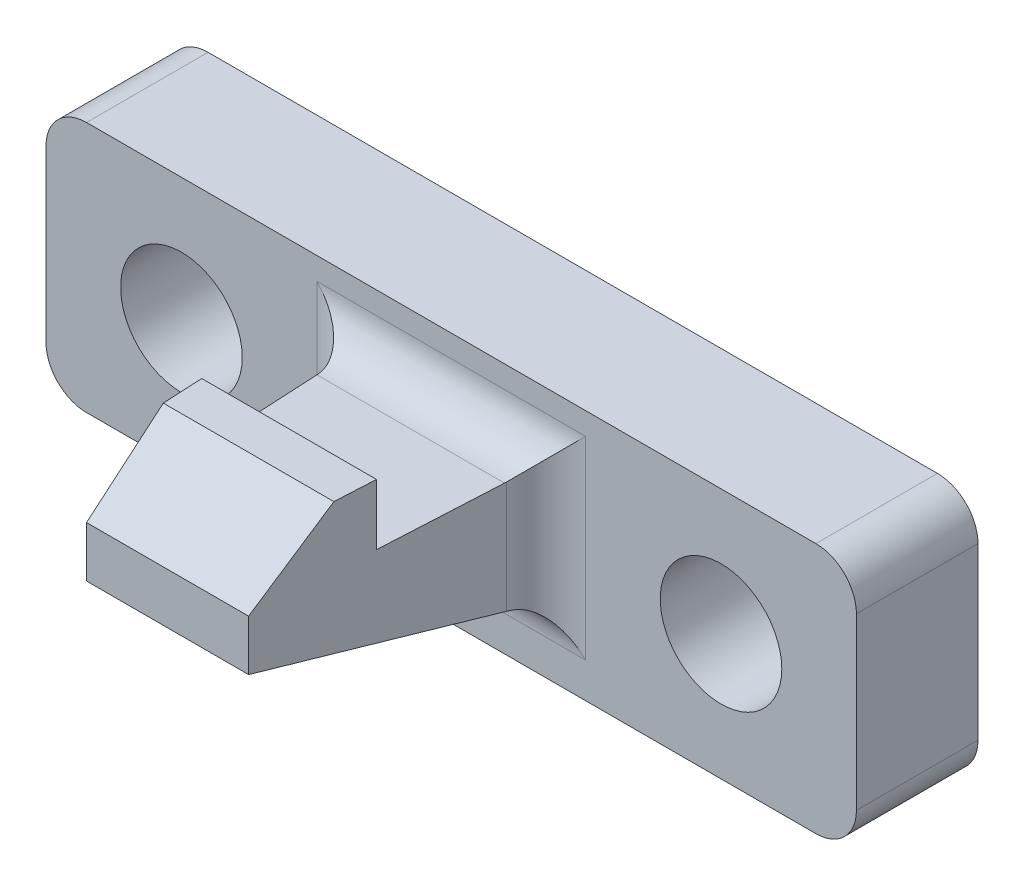
from build123d import *

# Parameters (mm, degrees)
SKETCH1_W           = 20
SKETCH1_H           = 6.2
BOSS_EXTRUDE1_DEPTH = 3
SNAP_START          = 0.3
SNAP_HOOK1_DEPTH    = 1.25
SNAP_START_2        = -2.157223338
SNAP_HOOK1_2_DEPTH  = 4.314446676
SNAP_START_3        = -2.366854455
SNAP_HOOK1_3_DEPTH  = 4.73370891
SNAP_START_4        = -2
SNAP_HOOK1_4_DEPTH  = 6
FILLET1_R           = 1
CUT_EXTRUDE1_REACH  = 14.594
SKETCH3_R           = 1.5
FILLET2_R           = 1


with BuildPart() as part:
    # Sketch1 → Boss-Extrude1 (new body)
    with BuildSketch(Plane.XY):
        Rectangle(SKETCH1_W, SKETCH1_H)
    extrude(amount=BOSS_EXTRUDE1_DEPTH)

    # Snap Hook1: read off the stored shape, not the designer's step
    # Snap Hook1 outline → Snap Hook1 (add)
    with BuildSketch(Plane(origin=(0, 0, 0), x_dir=(1, 0, 0), z_dir=(0, 1, 0)).offset(SNAP_START)):
        Polygon((2.366854455, -3), (-2.366854455, -3), (-2, -10), (2, -10), align=None)
    extrude(amount=SNAP_HOOK1_DEPTH)

    # Snap Hook1 2 outline → Snap Hook1 2 (add)
    with BuildSketch(Plane.YZ.offset(SNAP_START_2)):
        Polygon((0.3, 3), (0.3, 10), (-1.45, 3), align=None)
        Polygon((1.55, 10), (1.55, 7), (3.05, 7), (3.05, 8), align=None)
    extrude(amount=SNAP_HOOK1_2_DEPTH)

    # Snap Hook1 3 outline → Snap Hook1 3 (add)
    with BuildSketch(Plane.YZ.offset(SNAP_START_3)):
        Polygon((0.3, 3), (0.3, 10), (-1.45, 3), align=None)
    extrude(amount=SNAP_HOOK1_3_DEPTH)

    # Snap Hook1 4 outline → Snap Hook1 4 (cut)
    with BuildSketch(Plane(origin=(0, 0, 0), x_dir=(1, 0, 0), z_dir=(0, 1, 0)).offset(SNAP_START_4)):
        Polygon((-2.366854455, -3), (-2.366854455, -11), (-1.947592221, -11), (-2, -10), align=None)
        Polygon((2, -10), (1.947592221, -11), (2.366854455, -11), (2.366854455, -3), align=None)
    extrude(amount=SNAP_HOOK1_4_DEPTH, mode=Mode.SUBTRACT)

    # Fillet1
    # the kernel refuses this fillet: 1 mm, written as the material it adds along each edge
    with BuildSketch(Plane(origin=(4.866854455, 1.55, 3), x_dir=(0, 1, 0), z_dir=(-1, 0, 0))) as fillet1_piece_1_section:
        with BuildLine():
            CenterArc((FILLET1_R, -FILLET1_R), FILLET1_R, 90, 90)
            Line((0, -FILLET1_R), (0, 0))
            Line((0, 0), (FILLET1_R, 0))
        make_face()
    fillet1_piece_1 = extrude(amount=9.73370891, mode=Mode.PRIVATE)
    fillet1_piece_1 = split(fillet1_piece_1, bisect_by=Plane(origin=(-2.347040948, 1.55, 3.378064238), z_dir=(0.9986295347544344, 0, -0.05233595624560593)), keep=Keep.TOP, mode=Mode.PRIVATE)
    fillet1_piece_1 = split(fillet1_piece_1, bisect_by=Plane(origin=(2.373702086, 1.55, 2.869339421), z_dir=(-0.9986295347544344, 0, -0.05233595624560593)), keep=Keep.TOP, mode=Mode.PRIVATE)
    add(fillet1_piece_1)
    with BuildSketch(Plane(origin=(2.366854455, 1.55, 3), x_dir=(1, 0, 0), z_dir=(0, -1, 0))) as fillet1_piece_2_section:
        with BuildLine():
            CenterArc((FILLET1_R * 0.948964566712, FILLET1_R), FILLET1_R, 183, 87)
            Line((-FILLET1_R * 0.0496649680421, FILLET1_R * 0.947664043754), (0, 0))
            Line((0, 0), (FILLET1_R * 0.948964566712, 0))
        make_face()
    fillet1_piece_2 = extrude(amount=5.372411417, mode=Mode.PRIVATE)
    fillet1_piece_2 = split(fillet1_piece_2, bisect_by=Plane(origin=(2.366854455, -1.273529412, 3.705882353), z_dir=(0, 0.9701425001453319, -0.24253562503633297)), keep=Keep.TOP, mode=Mode.PRIVATE)
    add(fillet1_piece_2)
    with BuildSketch(Plane(origin=(4.318795471, -1.45, 3), x_dir=(0, -1, 0), z_dir=(-1, 0, 0))) as fillet1_piece_3_section:
        with BuildLine():
            CenterArc((FILLET1_R * 0.780776406404, FILLET1_R), FILLET1_R, 194.036243468, 75.963756532)
            Line((-FILLET1_R * 0.189366093741, FILLET1_R * 0.757464374964), (0, 0))
            Line((0, 0), (FILLET1_R * 0.780776406404, 0))
        make_face()
    fillet1_piece_3 = extrude(amount=8.637590942, mode=Mode.PRIVATE)
    fillet1_piece_3 = split(fillet1_piece_3, bisect_by=Plane(origin=(2.372200924, -1.45, 2.897983303), z_dir=(-0.9986295347544344, 0, -0.05233595624560593)), keep=Keep.TOP, mode=Mode.PRIVATE)
    fillet1_piece_3 = split(fillet1_piece_3, bisect_by=Plane(origin=(-2.34854211, -1.45, 3.349420356), z_dir=(0.9986295347544344, 0, -0.05233595624560593)), keep=Keep.TOP, mode=Mode.PRIVATE)
    add(fillet1_piece_3)
    with BuildSketch(Plane(origin=(-2.366854455, -3.822411417, 3), x_dir=(-1, 0, 0), z_dir=(0, 1, 0))) as fillet1_piece_4_section:
        with BuildLine():
            CenterArc((FILLET1_R * 0.948964566712, FILLET1_R), FILLET1_R, 183, 87)
            Line((-FILLET1_R * 0.0496649680421, FILLET1_R * 0.947664043754), (0, 0))
            Line((0, 0), (FILLET1_R * 0.948964566712, 0))
        make_face()
    fillet1_piece_4 = extrude(amount=5.372411417, mode=Mode.PRIVATE)
    fillet1_piece_4 = split(fillet1_piece_4, bisect_by=Plane(origin=(-2.366854455, -1.589553613, 2.441785549), z_dir=(0, 0.9701425001453319, -0.24253562503633297)), keep=Keep.TOP, mode=Mode.PRIVATE)
    add(fillet1_piece_4)
    with BuildSketch(Plane(origin=(2.366854455, 3.922411417, 3), x_dir=(1, 0, 0), z_dir=(0, -1, 0))) as fillet1_piece_5a_section:
        with BuildLine():
            CenterArc((FILLET1_R * 0.948964566712, FILLET1_R), FILLET1_R, 183, 87)
            Line((-FILLET1_R * 0.0496649680421, FILLET1_R * 0.947664043754), (0, 0))
            Line((0, 0), (FILLET1_R * 0.948964566712, 0))
        make_face()
    fillet1_piece_5a = extrude(amount=7.744822834, mode=Mode.PRIVATE)
    fillet1_piece_5a = split(fillet1_piece_5a, bisect_by=Plane(origin=(2.366854455, 3.1, 3), z_dir=(0, -1, 0)), keep=Keep.TOP, mode=Mode.PRIVATE)
    fillet1_piece_5a = split(fillet1_piece_5a, bisect_by=Plane(origin=(2.366854455, 1.55, 3), z_dir=(0, 1, 0)), keep=Keep.TOP, mode=Mode.PRIVATE)
    with BuildSketch(Plane(origin=(4.866854455, 1.55, 3), x_dir=(0, 1, 0), z_dir=(-1, 0, 0))) as fillet1_piece_5b_section:
        with BuildLine():
            CenterArc((FILLET1_R, -FILLET1_R), FILLET1_R, 90, 90)
            Line((0, -FILLET1_R), (0, 0))
            Line((0, 0), (FILLET1_R, 0))
        make_face()
    fillet1_piece_5b = extrude(amount=9.73370891, mode=Mode.PRIVATE)
    fillet1_piece_5b = split(fillet1_piece_5b, bisect_by=Plane(origin=(2.373702086, 1.55, 2.869339421), z_dir=(0.9986295347544344, 0, 0.05233595624560593)), keep=Keep.TOP, mode=Mode.PRIVATE)
    fillet1_piece_5 = fillet1_piece_5a & fillet1_piece_5b
    add(fillet1_piece_5)
    with BuildSketch(Plane(origin=(4.866854455, 1.55, 3), x_dir=(0, 1, 0), z_dir=(-1, 0, 0))) as fillet1_piece_6a_section:
        with BuildLine():
            CenterArc((FILLET1_R, -FILLET1_R), FILLET1_R, 90, 90)
            Line((0, -FILLET1_R), (0, 0))
            Line((0, 0), (FILLET1_R, 0))
        make_face()
    fillet1_piece_6a = extrude(amount=9.73370891, mode=Mode.PRIVATE)
    fillet1_piece_6a = split(fillet1_piece_6a, bisect_by=Plane(origin=(-2.347040948, 1.55, 3.378064238), z_dir=(-0.9986295347544344, 0, 0.05233595624560593)), keep=Keep.TOP, mode=Mode.PRIVATE)
    with BuildSketch(Plane(origin=(-2.366854455, -3.822411417, 3), x_dir=(-1, 0, 0), z_dir=(0, 1, 0))) as fillet1_piece_6b_section:
        with BuildLine():
            CenterArc((FILLET1_R * 0.948964566712, FILLET1_R), FILLET1_R, 183, 87)
            Line((-FILLET1_R * 0.0496649680421, FILLET1_R * 0.947664043754), (0, 0))
            Line((0, 0), (FILLET1_R * 0.948964566712, 0))
        make_face()
    fillet1_piece_6b = extrude(amount=7.744822834, mode=Mode.PRIVATE)
    fillet1_piece_6b = split(fillet1_piece_6b, bisect_by=Plane(origin=(-2.366854455, 3.1, 3), z_dir=(0, -1, 0)), keep=Keep.TOP, mode=Mode.PRIVATE)
    fillet1_piece_6b = split(fillet1_piece_6b, bisect_by=Plane(origin=(-2.366854455, 1.55, 3), z_dir=(0, 1, 0)), keep=Keep.TOP, mode=Mode.PRIVATE)
    fillet1_piece_6 = fillet1_piece_6a & fillet1_piece_6b
    add(fillet1_piece_6)
    with BuildSketch(Plane(origin=(2.366854455, 1.55, 3), x_dir=(1, 0, 0), z_dir=(0, -1, 0))) as fillet1_piece_7a_section:
        with BuildLine():
            CenterArc((FILLET1_R * 0.948964566712, FILLET1_R), FILLET1_R, 183, 87)
            Line((-FILLET1_R * 0.0496649680421, FILLET1_R * 0.947664043754), (0, 0))
            Line((0, 0), (FILLET1_R * 0.948964566712, 0))
        make_face()
    fillet1_piece_7a = extrude(amount=5.372411417, mode=Mode.PRIVATE)
    fillet1_piece_7a = split(fillet1_piece_7a, bisect_by=Plane(origin=(2.366854455, -3.1, 3), z_dir=(0, 1, 0)), keep=Keep.TOP, mode=Mode.PRIVATE)
    fillet1_piece_7a = split(fillet1_piece_7a, bisect_by=Plane(origin=(2.366854455, -1.273529412, 3.705882353), z_dir=(0, -0.9701425001453319, 0.24253562503633297)), keep=Keep.TOP, mode=Mode.PRIVATE)
    with BuildSketch(Plane(origin=(4.318795471, -1.45, 3), x_dir=(0, -1, 0), z_dir=(-1, 0, 0))) as fillet1_piece_7b_section:
        with BuildLine():
            CenterArc((FILLET1_R * 0.780776406404, FILLET1_R), FILLET1_R, 194.036243468, 75.963756532)
            Line((-FILLET1_R * 0.189366093741, FILLET1_R * 0.757464374964), (0, 0))
            Line((0, 0), (FILLET1_R * 0.780776406404, 0))
        make_face()
    fillet1_piece_7b = extrude(amount=8.637590942, mode=Mode.PRIVATE)
    fillet1_piece_7b = split(fillet1_piece_7b, bisect_by=Plane(origin=(2.372200924, -1.45, 2.897983303), z_dir=(0.9986295347544344, 0, 0.05233595624560593)), keep=Keep.TOP, mode=Mode.PRIVATE)
    fillet1_piece_7 = fillet1_piece_7a & fillet1_piece_7b
    add(fillet1_piece_7)
    with BuildSketch(Plane(origin=(-2.366854455, -3.822411417, 3), x_dir=(-1, 0, 0), z_dir=(0, 1, 0))) as fillet1_piece_8a_section:
        with BuildLine():
            CenterArc((FILLET1_R * 0.948964566712, FILLET1_R), FILLET1_R, 183, 87)
            Line((-FILLET1_R * 0.0496649680421, FILLET1_R * 0.947664043754), (0, 0))
            Line((0, 0), (FILLET1_R * 0.948964566712, 0))
        make_face()
    fillet1_piece_8a = extrude(amount=5.372411417, mode=Mode.PRIVATE)
    fillet1_piece_8a = split(fillet1_piece_8a, bisect_by=Plane(origin=(-2.366854455, -3.1, 3), z_dir=(0, 1, 0)), keep=Keep.TOP, mode=Mode.PRIVATE)
    fillet1_piece_8a = split(fillet1_piece_8a, bisect_by=Plane(origin=(-2.366854455, -1.589553613, 2.441785549), z_dir=(0, -0.9701425001453319, 0.24253562503633297)), keep=Keep.TOP, mode=Mode.PRIVATE)
    with BuildSketch(Plane(origin=(4.318795471, -1.45, 3), x_dir=(0, -1, 0), z_dir=(-1, 0, 0))) as fillet1_piece_8b_section:
        with BuildLine():
            CenterArc((FILLET1_R * 0.780776406404, FILLET1_R), FILLET1_R, 194.036243468, 75.963756532)
            Line((-FILLET1_R * 0.189366093741, FILLET1_R * 0.757464374964), (0, 0))
            Line((0, 0), (FILLET1_R * 0.780776406404, 0))
        make_face()
    fillet1_piece_8b = extrude(amount=8.637590942, mode=Mode.PRIVATE)
    fillet1_piece_8b = split(fillet1_piece_8b, bisect_by=Plane(origin=(-2.34854211, -1.45, 3.349420356), z_dir=(-0.9986295347544344, 0, 0.05233595624560593)), keep=Keep.TOP, mode=Mode.PRIVATE)
    fillet1_piece_8 = fillet1_piece_8a & fillet1_piece_8b
    add(fillet1_piece_8)

    # Sketch3 → Cut-Extrude1 (cut, up to next)
    with BuildSketch(Plane.XY.offset(3), mode=Mode.PRIVATE) as cut_extrude1_sk1:
        with Locations((-6.657909511, 0)):
            Circle(SKETCH3_R)
    cut_extrude1_tool1 = extrude(cut_extrude1_sk1.sketch, amount=-CUT_EXTRUDE1_REACH, mode=Mode.PRIVATE) & part.part
    cut_extrude1 = cut_extrude1_tool1.solids().sort_by_distance((-6.65791, 0, 3))[0]
    add(cut_extrude1, mode=Mode.SUBTRACT)

    # Mirror1: Cut-Extrude1 across plane
    add(cut_extrude1.mirror(Plane(origin=(0, 0, 0), x_dir=(0, 0, 1), z_dir=(1, 0, 0))), mode=Mode.SUBTRACT)

    # Fillet2
    fillet2_edges = [part.edges().sort_by_distance(p)[0] for p in [
        (10, -3.1, 1.5),
        (-10, -3.1, 1.5),
        (-10, 3.1, 1.5),
        (10, 3.1, 1.5),
    ]]
    fillet(fillet2_edges, radius=FILLET2_R)


solid = part.part
